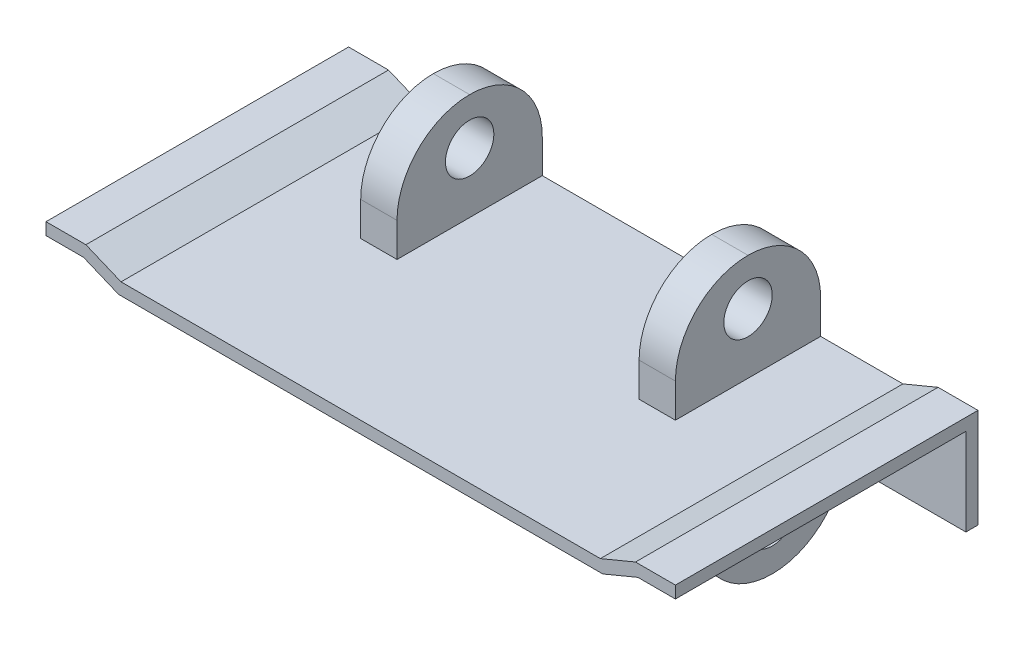
from build123d import *

# Parameters (mm, degrees)
SKETCH2_W                 = 5
SKETCH2_H                 = 12
BOSS_EXTRUDE1_DEPTH       = 12
BOSS_EXTRUDE1_2_DEPTH     = 12
BOSS_EXTRUDE3_DEPTH       = 25
SKETCH5_W                 = 3
SKETCH5_H                 = 8.8
BOSS_EXTRUDE4_DEPTH       = 12
SKETCH7_W                 = 2
SKETCH7_H                 = 12
BOSS_EXTRUDE5_DEPTH       = 12
SKETCH15_W                = 0.2
SKETCH15_H                = 12
CUT_EXTRUDE2_DEPTH        = 12
SKETCH16_W                = 0.15
SKETCH16_H                = 12
CUT_EXTRUDE3_DEPTH        = 12
FILLET1_R                 = 6
F_4_0MM_DOWEL_HOLE2_D     = 4
FILLET2_R                 = 6
F_4_0MM_DOWEL_HOLE1_D     = 4
F_4_0MM_DOWEL_HOLE1_DEPTH = 26
F_4_0MM_DOWEL_HOLE1_TIP   = 1.201721238
BOSS_EXTRUDE6_DEPTH       = 1
CUT_EXTRUDE4_DEPTH        = 2.4


with BuildPart() as part:
    # Sketch2 → Boss-Extrude1 (new body)
    with BuildSketch(Plane.XY):
        with Locations((-7.5, 0)):
            Rectangle(SKETCH2_W, SKETCH2_H)
    extrude(amount=BOSS_EXTRUDE1_DEPTH)



with BuildPart() as body_2:
    # Sketch2 → Boss-Extrude1 2 (new body)
    with BuildSketch(Plane.XY):
        with Locations((7.5, 0)):
            Rectangle(SKETCH2_W, SKETCH2_H)
    extrude(amount=BOSS_EXTRUDE1_2_DEPTH)


with BuildPart() as part_1:
    add(part.part)

    add(body_2.part)  # Boss-Extrude3 merges body 2
    # Sketch4 → Boss-Extrude3 (add)
    with BuildSketch(Plane.XY):
        Polygon((-10, 6), (-20, 6), (-22.901603942, 7.206366686), (-26, 7.206366686), (-26, 8.206366686), (-22.7020064, 8.206366686), (-19.800402458, 7), (-10, 7), (10, 7), (19.800402458, 7), (22.7020064, 8.206366686), (26, 8.206366686), (26, 7.206366686), (22.901603942, 7.206366686), (20, 6), (10, 6), align=None)
    extrude(amount=BOSS_EXTRUDE3_DEPTH)

    # Sketch5 → Boss-Extrude4 (add)
    with BuildSketch(Plane.XY):
        with Locations((-11.5, 11.4)):
            Rectangle(SKETCH5_W, SKETCH5_H)
        with Locations((11.5, 11.4)):
            Rectangle(SKETCH5_W, SKETCH5_H)
    extrude(amount=BOSS_EXTRUDE4_DEPTH)

    # Sketch7 → Boss-Extrude5 (add)
    with BuildSketch(Plane.XY):
        with Locations((-14, 0)):
            Rectangle(SKETCH7_W, SKETCH7_H)
        with Locations((14, 0)):
            Rectangle(SKETCH7_W, SKETCH7_H)
    extrude(amount=BOSS_EXTRUDE5_DEPTH)

    # Sketch15 → Cut-Extrude2 (cut)
    with BuildSketch(Plane.XZ.offset(6)):
        with Locations((-9.9, 6)):
            Rectangle(SKETCH15_W, SKETCH15_H)
        with Locations((9.9, 6)):
            Rectangle(SKETCH15_W, SKETCH15_H)
        with Locations((-13.1, 6)):
            Rectangle(SKETCH15_W, SKETCH15_H)
        with Locations((13.1, 6)):
            Rectangle(SKETCH15_W, SKETCH15_H)
    extrude(amount=-CUT_EXTRUDE2_DEPTH, mode=Mode.SUBTRACT)

    # Sketch16 → Cut-Extrude3 (cut)
    with BuildSketch(Plane.XZ.offset(6)):
        with Locations((-5.075, 6)):
            Rectangle(SKETCH16_W, SKETCH16_H)
        with Locations((5.075, 6)):
            Rectangle(SKETCH16_W, SKETCH16_H)
    extrude(amount=-CUT_EXTRUDE3_DEPTH, mode=Mode.SUBTRACT)

    # Fillet1
    fillet1_edges = [part_1.edges().sort_by_distance(p)[0] for p in [
        (7.475, -6, 0),
        (7.475, -6, 12),
        (-7.475, -6, 0),
        (-7.475, -6, 12),
        (-14.1, -6, 0),
        (-14.1, -6, 12),
        (14.1, -6, 12),
        (14.1, -6, 0),
    ]]
    fillet(fillet1_edges, radius=FILLET1_R - 0.0001)  # a hair under: the kernel refuses the full size

    # Ø4.0mm Dowel Hole2 (through all)
    with Locations(Plane(origin=(15, 0, 0), x_dir=(0, 0, -1), z_dir=(1, 0, 0))):
        with Locations((-6, -2)):
            Hole(F_4_0MM_DOWEL_HOLE2_D / 2)

    # Fillet2
    fillet2_edges = [part_1.edges().sort_by_distance(p)[0] for p in [
        (-11.5, 15.8, 0),
        (-11.5, 15.8, 12),
        (11.5, 15.8, 0),
        (11.5, 15.8, 12),
    ]]
    fillet(fillet2_edges, radius=FILLET2_R - 0.0001)  # a hair under: the kernel refuses the full size

    # Ø4.0mm Dowel Hole1
    with Locations(Plane(origin=(13, 0, 0), x_dir=(0, 0, -1), z_dir=(1, 0, 0))):
        with Locations((-6, 11.975)):
            Hole(F_4_0MM_DOWEL_HOLE1_D / 2, depth=F_4_0MM_DOWEL_HOLE1_DEPTH)
            with Locations((0, 0, -(F_4_0MM_DOWEL_HOLE1_DEPTH + F_4_0MM_DOWEL_HOLE1_TIP / 2))):  # 118° drill point
                Cone(0, F_4_0MM_DOWEL_HOLE1_D / 2, F_4_0MM_DOWEL_HOLE1_TIP, mode=Mode.SUBTRACT)

    # Sketch14 → Boss-Extrude6 (add)
    with BuildSketch(Plane.XY):
        Polygon((-22.901603942, 7.206366686), (-26, 7.206366686), (-26, 0), (-15, 0), (-15, 6), (-20, 6), align=None)
        Polygon((20, 6), (15, 6), (15, 0), (26, 0), (26, 7.206366686), (22.901603942, 7.206366686), align=None)
    extrude(amount=BOSS_EXTRUDE6_DEPTH)

    # Sketch18 → Cut-Extrude4 (cut)
    with BuildSketch(Plane(origin=(-5.15, 0, 0), x_dir=(0, 0, -1), z_dir=(1, 0, 0))):
        Polygon((-2.918757855, -0.688786755), (-5.594922908, 1.324040596), (-8.676165053, 0.01282735), (-9.081242145, -3.311213245), (-6.405077092, -5.324040596), (-3.323834947, -4.01282735), align=None)
    cut_extrude4 = extrude(amount=-CUT_EXTRUDE4_DEPTH, mode=Mode.SUBTRACT)

    # Mirror1: Cut-Extrude4 across plane
    add(cut_extrude4.mirror(Plane(origin=(0, 0, 0), x_dir=(0, 0, 1), z_dir=(1, 0, 0))), mode=Mode.SUBTRACT)


solid = part_1.part
